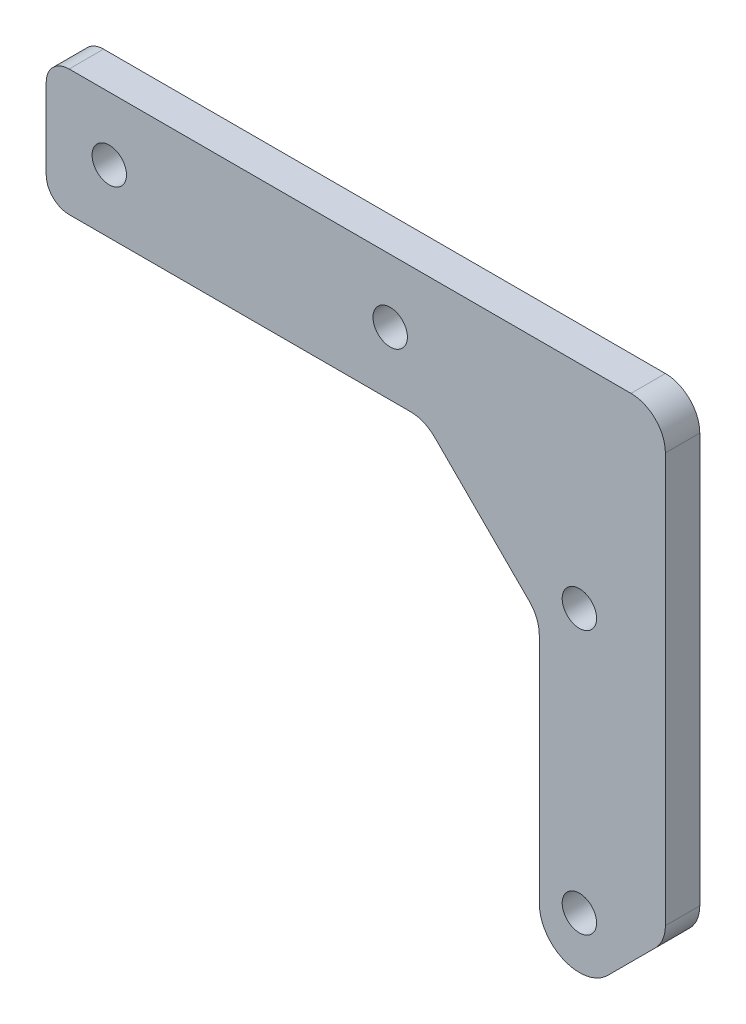
from build123d import *

# Parameters (mm, degrees)
SKETCH_1_R         = 1.5
EXTRUDE_1190_DEPTH = 3
FILLET1_R          = 3
FILLET_1_R         = 2


with BuildPart() as part:
    # Эскиз1 → Extrude 1190 (new body)
    with BuildSketch(Plane.XY):
        with BuildLine():
            Line((-48.5, 5.5), (-48.5, -5.5))
            Line((-48.5, -5.5), (-15.5, -5.5))
            Line((-15.5, -5.5), (-5.5, -15.5))
            Line((-5.5, -15.5), (-5.5, -37))
            ThreePointArc((-5.5, -37), (-3.339392013, -40.233578364), (0.474873734, -39.474873734))
            Line((0.474873734, -39.474873734), (5.5, -34.449747468))
            Line((5.5, -34.449747468), (5.5, 5.5))
            Line((5.5, 5.5), (-48.5, 5.5))
        make_face()
        with Locations((-18.5, 0)):
            Circle(SKETCH_1_R, mode=Mode.SUBTRACT)
        with Locations((-43, 0)):
            Circle(SKETCH_1_R, mode=Mode.SUBTRACT)
        with Locations((-2, -13)):
            Circle(SKETCH_1_R, mode=Mode.SUBTRACT)
        with Locations((-2, -36)):
            Circle(SKETCH_1_R, mode=Mode.SUBTRACT)
    extrude(amount=EXTRUDE_1190_DEPTH)

    # Fillet1
    fillet1_edges = [part.edges().sort_by_distance(p)[0] for p in [
        (5.5, 5.5, 1.5),
        (5.5, -34.449747468, 1.5),
        (-5.5, -15.5, 1.5),
        (-15.5, -5.5, 1.5),
    ]]
    fillet(fillet1_edges, radius=FILLET1_R)

    # Скругление1
    fillet_1_edges = [part.edges().sort_by_distance(p)[0] for p in [
        (-48.5, 5.5, 1.5),
        (-48.5, -5.5, 1.5),
    ]]
    fillet(fillet_1_edges, radius=FILLET_1_R)


solid = part.part
